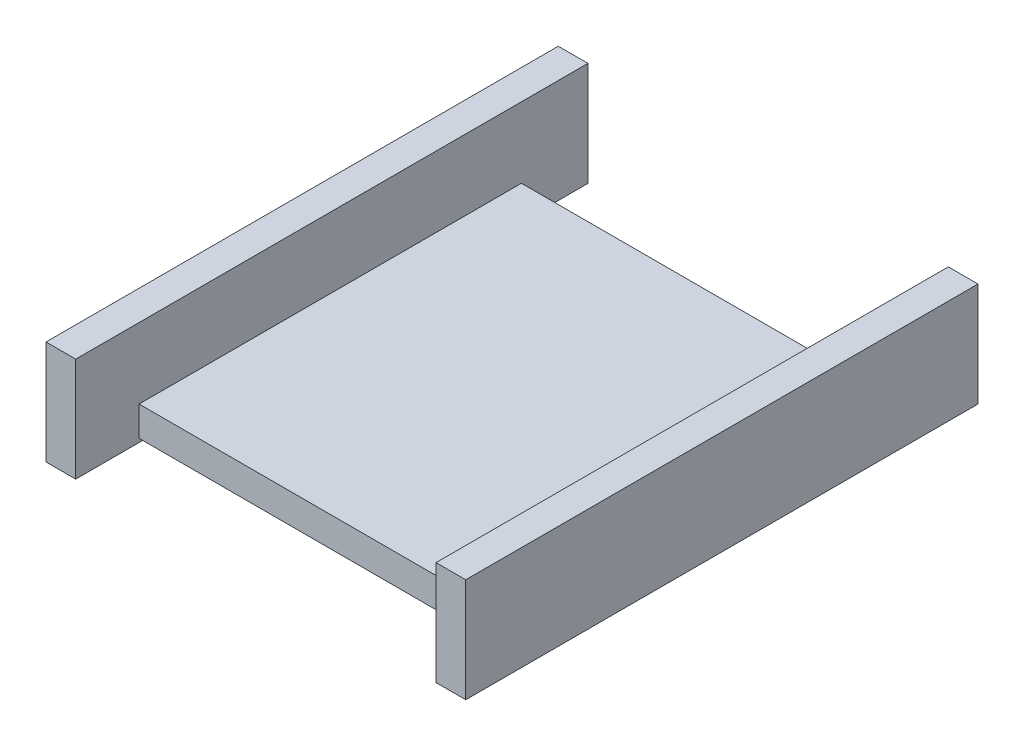
from build123d import *

# Parameters (mm, degrees)
SKETCH_1_W      = 138
SKETCH_1_H      = 28
EXTRUDE_1_DEPTH = 8
SKETCH_2_W      = 103
SKETCH_2_H      = 8
EXTRUDE_2_DEPTH = 97
SKETCH_3_W      = 138
SKETCH_3_H      = 28
EXTRUDE_3_DEPTH = 8


with BuildPart() as part:
    # 草图1 → 凸台-拉伸1 (new body)
    with BuildSketch(Plane(origin=(0, 0, 0), x_dir=(0, 0, -1), z_dir=(1, 0, 0))):
        Rectangle(SKETCH_1_W, SKETCH_1_H)
    extrude(amount=EXTRUDE_1_DEPTH)

    # 草图2 → 凸台-拉伸2 (add)
    with BuildSketch(Plane.ZY):
        with Locations((0.5, -10)):
            Rectangle(SKETCH_2_W, SKETCH_2_H)
    extrude(amount=EXTRUDE_2_DEPTH)

    # 草图3 → 凸台-拉伸3 (add)
    with BuildSketch(Plane.ZY.offset(97)):
        with Locations((0.070183463, -0.989678925)):
            Rectangle(SKETCH_3_W, SKETCH_3_H)
    extrude(amount=EXTRUDE_3_DEPTH)


solid = part.part
